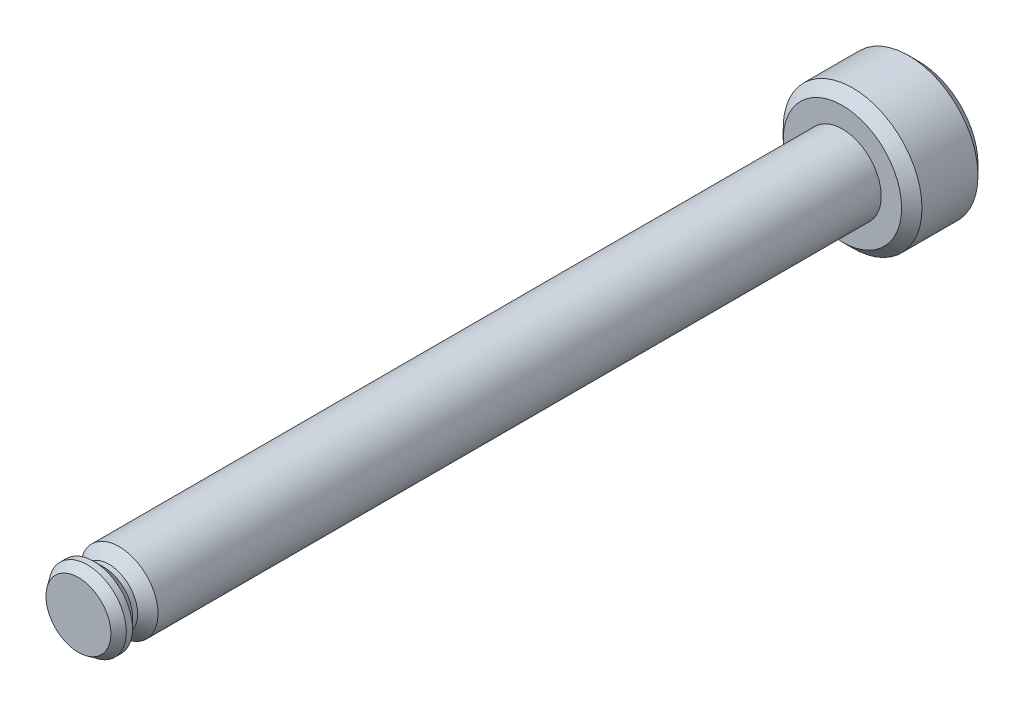
from build123d import *

# Parameters (mm, degrees)
SKETCH2_R      = 1.525
SHAFT_DEPTH    = 30
SKETCH5_R      = 2.725
HEAD_DEPTH     = 3
CHAMFER1_SIZE  = 0.25
CHAMFER1_SIZE2 = 0.357037002
DEBURS_SIZE    = 0.4


with BuildPart() as part:
    # Sketch2 → Shaft (new body)
    with BuildSketch(Plane.XY):
        Circle(SKETCH2_R)
    extrude(amount=SHAFT_DEPTH)

    # Sketch5 → Head (add)
    with BuildSketch(Plane.XY):
        Circle(SKETCH5_R)
    extrude(amount=-HEAD_DEPTH)

    # Chamfer1
    chamfer1_edges = [part.edges().sort_by_distance(p)[0] for p in [
        (-1.525, 0, 30),
    ]]
    chamfer1_side = [part.faces().sort_by_distance(p)[0] for p in [
        (0, 0, 30),
    ]]
    chamfer(chamfer1_edges, length=CHAMFER1_SIZE, length2=CHAMFER1_SIZE2, reference=chamfer1_side[0])

    # Deburs
    deburs_edges = [part.edges().sort_by_distance(p)[0] for p in [
        (-2.725, 0, 0),
        (-2.725, 0, -3),
    ]]
    chamfer(deburs_edges, length=DEBURS_SIZE)

    # Sketch6 → e-Clip Notch Long (revolve, cut)
    with BuildSketch(Plane(origin=(0, 0, 0), x_dir=(0, 0, -1), z_dir=(1, 0, 0))):
        Polygon((-29.4, 1.525), (-28.4, 1.525), (-28.8, 1.125), (-29, 1.125), align=None)
    revolve(axis=Axis((0, 0, 0), (0, 0, 1)), mode=Mode.SUBTRACT)


solid = part.part
